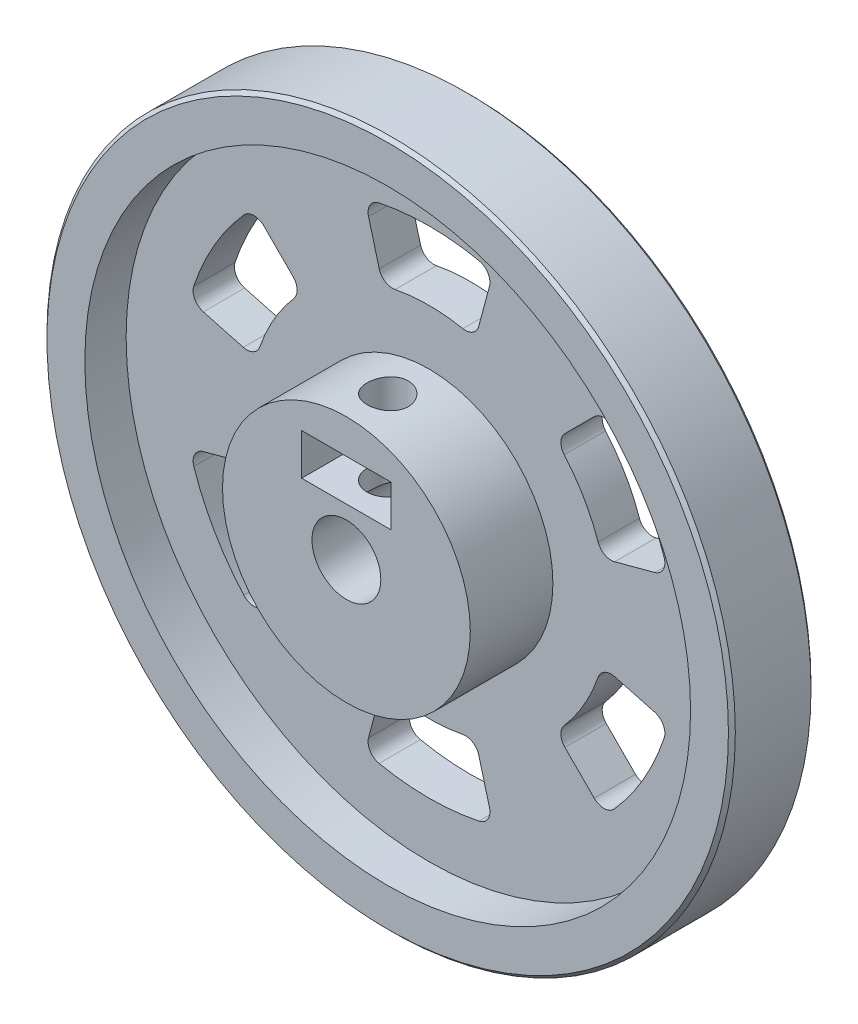
from build123d import *

# Parameters (mm, degrees)
SKETCH1_R               = 25
BOSS_EXTRUDE1_DEPTH     = 3
SKETCH3_R               = 25
SKETCH3_R_2             = 22
BOSS_EXTRUDE3_DEPTH     = 6
SKETCH4_R               = 9
BOSS_EXTRUDE4_DEPTH     = 9
SKETCH5_R               = 2.5
CUT_EXTRUDE1_DEPTH      = 37.482872694
SKETCH6_W               = 6.5
SKETCH6_H               = 3
CUT_EXTRUDE2_DEPTH      = 6.5
CUT_EXTRUDE3_REACH      = 38.483
CUT_EXTRUDE3_END_RADIUS = 9
SKETCH7_R               = 1.5
CUT_EXTRUDE4_DEPTH      = 37.482872719
CIRPATTERN1_COUNT       = 6
CHAMFER1_SIZE           = 0.25


with BuildPart() as part:
    # Sketch1 → Boss-Extrude1 (new body)
    with BuildSketch(Plane.XY):
        Circle(SKETCH1_R)
    extrude(amount=BOSS_EXTRUDE1_DEPTH)

    # Sketch3 → Boss-Extrude3 (add)
    with BuildSketch(Plane.XY):
        Circle(SKETCH3_R)
        Circle(SKETCH3_R_2, mode=Mode.SUBTRACT)
    extrude(amount=BOSS_EXTRUDE3_DEPTH)

    # Sketch4 → Boss-Extrude4 (add)
    with BuildSketch(Plane.XY):
        Circle(SKETCH4_R)
    extrude(amount=BOSS_EXTRUDE4_DEPTH)

    # Sketch5 → Cut-Extrude1 (cut, through all)
    with BuildSketch(Plane.XY):
        Circle(SKETCH5_R)
    extrude(amount=CUT_EXTRUDE1_DEPTH, mode=Mode.SUBTRACT)

    # Sketch6 → Cut-Extrude2 (cut)
    with BuildSketch(Plane.XY.offset(9)):
        with Locations((0, 5)):
            Rectangle(SKETCH6_W, SKETCH6_H)
    extrude(amount=-CUT_EXTRUDE2_DEPTH, mode=Mode.SUBTRACT)

    # Cut-Extrude3: up to this cylinder (the profile starts inside it)
    cut_extrude3_end = Plane(origin=(0, 0, 6), z_dir=(0, 0, -1)) * Cylinder(CUT_EXTRUDE3_END_RADIUS, 95.966, mode=Mode.PRIVATE)
    # Sketch7 → Cut-Extrude3 (cut, up to the surface)
    with BuildSketch(Plane(origin=(0, 0, 0), x_dir=(1, 0, 0), z_dir=(0, 1, 0)), mode=Mode.PRIVATE) as cut_extrude3_sk1:
        with Locations((0, -6)):
            Circle(SKETCH7_R)
    cut_extrude3_tool1 = extrude(cut_extrude3_sk1.sketch, amount=CUT_EXTRUDE3_REACH, mode=Mode.PRIVATE) & cut_extrude3_end
    add(cut_extrude3_tool1.solids().sort_by_distance((0, 0, 6))[0], mode=Mode.SUBTRACT)

    # Sketch8 → Cut-Extrude4 (cut, through all)
    with BuildSketch(Plane.XY):
        with BuildLine():
            Line((-4.392304845, 16.392304845), (-3.614211274, 13.488420103))
            ThreePointArc((-3.614211274, 13.488420103), (-3.178915308, 12.899635496), (-2.459122201, 12.765293494))
            ThreePointArc((-2.459122201, 12.765293494), (0, 13), (2.459122201, 12.765293494))
            ThreePointArc((2.459122201, 12.765293494), (3.178915308, 12.899635496), (3.614211274, 13.488420103))
            Line((3.614211274, 13.488420103), (4.392304845, 16.392304845))
            ThreePointArc((4.392304845, 16.392304845), (4.277317186, 17.176389762), (3.627930726, 17.630601766))
            ThreePointArc((3.627930726, 17.630601766), (0, 18), (-3.627930726, 17.630601766))
            ThreePointArc((-3.627930726, 17.630601766), (-4.277317186, 17.176389762), (-4.392304845, 16.392304845))
        make_face()
    cut_extrude4 = extrude(amount=CUT_EXTRUDE4_DEPTH, mode=Mode.SUBTRACT)

    # CirPattern1: Cut-Extrude4 ×6 about axis
    cirpattern1_axis = Axis((0, 0, 9), (0, 0, 1))
    for i in range(1, CIRPATTERN1_COUNT):
        add(cut_extrude4.rotate(cirpattern1_axis, i * 360 / CIRPATTERN1_COUNT), mode=Mode.SUBTRACT)

    # Chamfer1
    chamfer1_edges = [part.edges().sort_by_distance(p)[0] for p in [
        (-25, 0, 6),
        (-25, 0, 0),
    ]]
    chamfer(chamfer1_edges, length=CHAMFER1_SIZE)


solid = part.part
